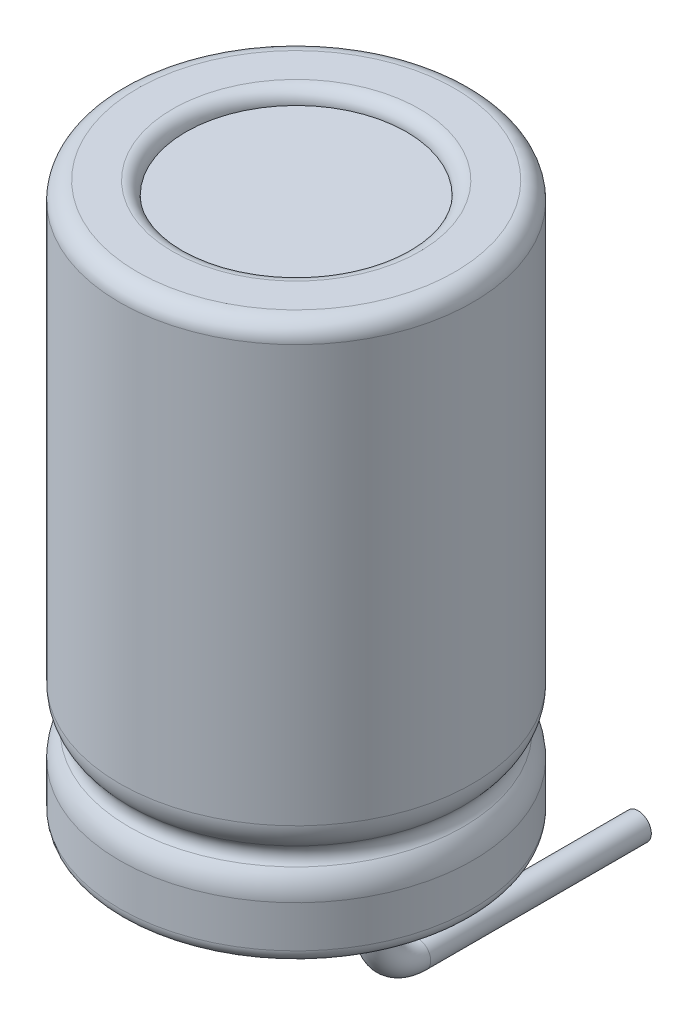
from build123d import *

# Parameters (mm, degrees)
SKETCH_2_R          = 4
EXTRUDE_1_DEPTH     = 12.6
SKETCH_3_R          = 2.5
CUT_EXTRUDE_1_DEPTH = 0.3
SKETCH_4_R          = 0.3
CUT_EXTRUDE_START   = -0.3
SKETCH_7_R          = 2.5
CUT_EXTRUDE_2_DEPTH = 0.3
FILLET_1_R          = 0.3
FILLET_2_R          = 0.8
FILLET_3_R          = 0.4
FILLET_4_R          = 0.3
FILLET_5_R          = 0.3


with BuildPart() as part:
    # Эскиз2 → Бобышка-Вытянуть1 (new body)
    with BuildSketch(Plane(origin=(0, 0, 0), x_dir=(1, 0, 0), z_dir=(0, 1, 0))):
        with Locations(Location((0, 0, 0), (0, 0, 270))):
            Circle(SKETCH_2_R)
    extrude(amount=EXTRUDE_1_DEPTH)

    # Эскиз3 → Вырез-Вытянуть1 (cut)
    with BuildSketch(Plane.XZ):
        with Locations(Location((0, 0, 0), (0, 0, 270))):
            Circle(SKETCH_3_R)
    extrude(amount=-CUT_EXTRUDE_1_DEPTH, mode=Mode.SUBTRACT)

    # Эскиз7 → Вырез-Вытянуть2 (cut)
    with BuildSketch(Plane(origin=(0, 12.6, 0), x_dir=(1, 0, 0), z_dir=(0, 1, 0)).offset(CUT_EXTRUDE_START)):
        with Locations(Location((0, 0, 0), (0, 0, 90))):
            Circle(SKETCH_7_R)
    extrude(amount=CUT_EXTRUDE_2_DEPTH, mode=Mode.SUBTRACT)

    # Эскиз9 → Вырез-Повернуть1 (revolve, cut)
    with BuildSketch(Plane(origin=(0, 0, 0), x_dir=(0, 0, -1), z_dir=(1, 0, 0)), mode=Mode.PRIVATE) as cut_revolve_1_sk:
        with BuildLine():
            Line((-4, 2.3), (-4, 1.7))
            ThreePointArc((-4, 1.7), (-3.7, 2), (-4, 2.3))
        make_face()
    revolve(cut_revolve_1_sk.sketch.rotate(Axis((0, -2.369211138, 0), (0, 1, 0)), 180), axis=Axis((0, -2.369211138, 0), (0, 1, 0)), mode=Mode.SUBTRACT)

    # Скругление1
    fillet_1_edges = [part.edges().sort_by_distance(p)[0] for p in [
        (0, 0, 2.5),
    ]]
    fillet(fillet_1_edges, radius=FILLET_1_R - 0.0001)  # a hair under: the kernel refuses the full size

    # Скругление2
    fillet_2_edges = [part.edges().sort_by_distance(p)[0] for p in [
        (-4, 1.7, 0),
        (-4, 2.3, 0),
    ]]
    fillet(fillet_2_edges, radius=FILLET_2_R)

    # Скругление3
    fillet_3_edges = [part.edges().sort_by_distance(p)[0] for p in [
        (0, 12.6, -4),
    ]]
    fillet(fillet_3_edges, radius=FILLET_3_R)

    # Скругление4
    fillet_4_edges = [part.edges().sort_by_distance(p)[0] for p in [
        (0, 12.6, 2.5),
    ]]
    fillet(fillet_4_edges, radius=FILLET_4_R - 0.0001)  # a hair under: the kernel refuses the full size

    # Скругление5
    fillet_5_edges = [part.edges().sort_by_distance(p)[0] for p in [
        (0, 0, -4),
    ]]
    fillet(fillet_5_edges, radius=FILLET_5_R)


with BuildPart() as body_2:
    # По траектории1: sweep along a path in Эскиз6
    with BuildLine(Plane.ZY.offset(1.75)) as sweep_1_path:
        Line((0, 0.3), (0, -1.2))
        ThreePointArc((0, -1.2), (-0.292893219, -1.907106781), (-1, -2.2))
        Line((-1, -2.2), (-6, -2.2))
    # Эскиз4 → По траектории1 (sweep)
    with BuildSketch(Plane.XZ.offset(-0.3)):
        with Locations((-1.75, 0)):
            Circle(SKETCH_4_R)
    sweep(path=sweep_1_path.line)


with BuildPart() as body_3:
    # Зеркальное отражение1: mirrored copy
    add(body_2.part.mirror(Plane(origin=(0, 0, 0), x_dir=(0, 0, 1), z_dir=(1, 0, 0))))


solid = Compound([part.part, body_2.part, body_3.part])
